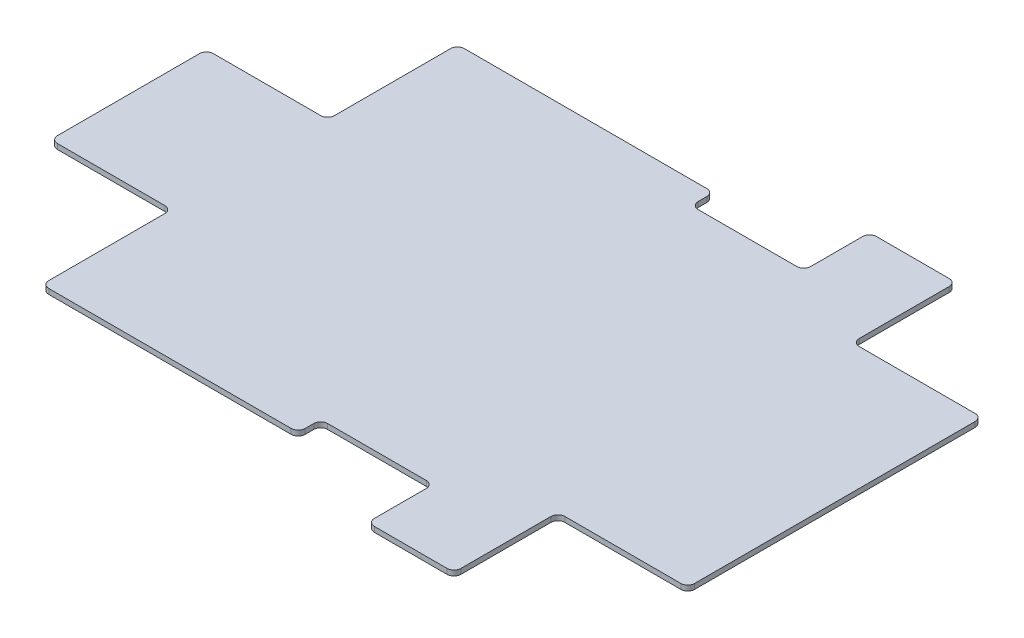
from build123d import *

# Parameters (mm, degrees)
SALIENTE_EXTRUIR1_DEPTH = 3
REDONDEO1_R             = 4


with BuildPart() as part:
    # Croquis1 → Saliente-Extruir1 (new body)
    with BuildSketch(Plane(origin=(0, 0, 0), x_dir=(1, 0, 0), z_dir=(0, 1, 0))):
        Polygon((0, 0), (-408, 0), (-408, 45), (-338, 45), (-338, 120), (-190, 120), (-190, 107), (-125, 107), (-125, 145), (-75, 145), (-75, 85), (0, 85), align=None)
    saliente_extruir1 = extrude(amount=SALIENTE_EXTRUIR1_DEPTH)

    # Simetría1: Saliente-Extruir1 across plane
    add(saliente_extruir1.mirror(Plane(origin=(0, 3, 0), x_dir=(1, 0, 0), z_dir=(0, 0, -1))))

    # Redondeo1
    redondeo1_edges = [part.edges().sort_by_distance(p)[0] for p in [
        (-408, 1.5, -45),
        (-338, 1.5, -45),
        (-338, 1.5, -120),
        (-190, 1.5, -120),
        (-190, 1.5, -107),
        (-125, 1.5, -107),
        (-125, 1.5, -145),
        (-75, 1.5, -85),
        (-75, 1.5, -145),
        (0, 1.5, -85),
        (0, 1.5, 85),
        (-75, 1.5, 85),
        (-75, 1.5, 145),
        (-125, 1.5, 145),
        (-125, 1.5, 107),
        (-190, 1.5, 107),
        (-190, 1.5, 120),
        (-338, 1.5, 120),
        (-338, 1.5, 45),
        (-408, 1.5, 45),
    ]]
    fillet(redondeo1_edges, radius=REDONDEO1_R)


solid = part.part
